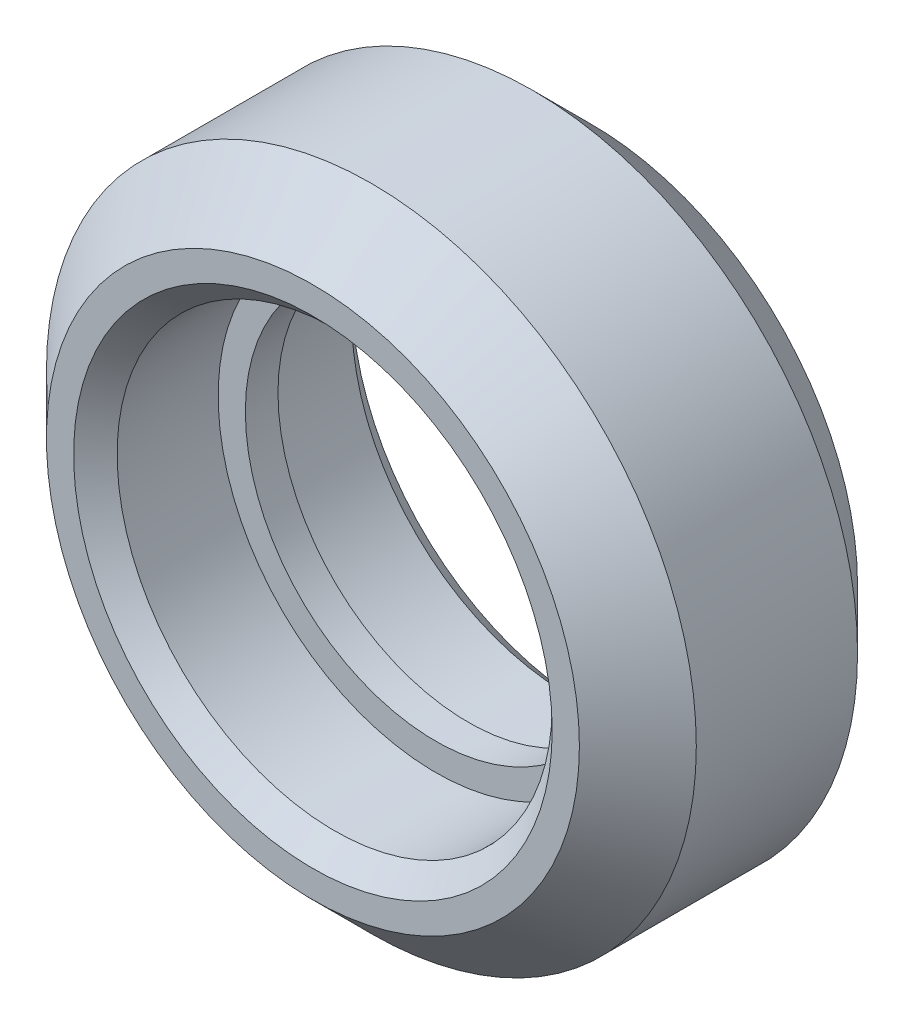
from build123d import *

# Parameters (mm, degrees)
SKETCH_1_R          = 11.95
EXTRUDE_1_DEPTH     = 10.23
SKETCH_2_R          = 7
CUT_EXTRUDE_1_DEPTH = 20.754946216
CHAMFER_1_SIZE      = 2.15
SKETCH_3_R          = 8
CUT_EXTRUDE_2_DEPTH = 4.515
CHAMFER_2_SIZE      = 0.8


with BuildPart() as part:
    # Эскиз1 → Бобышка-Вытянуть1 (new body)
    with BuildSketch(Plane.XY):
        Circle(SKETCH_1_R)
    extrude(amount=EXTRUDE_1_DEPTH)

    # Эскиз2 → Вырез-Вытянуть1 (cut, through all)
    with BuildSketch(Plane.XY.offset(10.23)):
        Circle(SKETCH_2_R)
    extrude(amount=-CUT_EXTRUDE_1_DEPTH, mode=Mode.SUBTRACT)

    # Фаска1
    chamfer_1_edges = [part.edges().sort_by_distance(p)[0] for p in [
        (-11.95, 0, 0),
        (-11.95, 0, 10.23),
    ]]
    chamfer(chamfer_1_edges, length=CHAMFER_1_SIZE)

    # Эскиз3 → Вырез-Вытянуть2 (cut)
    with BuildSketch(Plane.XY.offset(10.23)):
        Circle(SKETCH_3_R)
    cut_extrude_2 = extrude(amount=-CUT_EXTRUDE_2_DEPTH, mode=Mode.SUBTRACT)

    # Зеркальное отражение1: Вырез-Вытянуть2 across plane
    add(cut_extrude_2.mirror(Plane(origin=(0, 0, 5.115), x_dir=(1, 0, 0), z_dir=(0, 0, -1))), mode=Mode.SUBTRACT)

    # Фаска2
    chamfer_2_edges = [part.edges().sort_by_distance(p)[0] for p in [
        (-8, 0, 0),
        (-8, 0, 10.23),
    ]]
    chamfer(chamfer_2_edges, length=CHAMFER_2_SIZE)


solid = part.part
